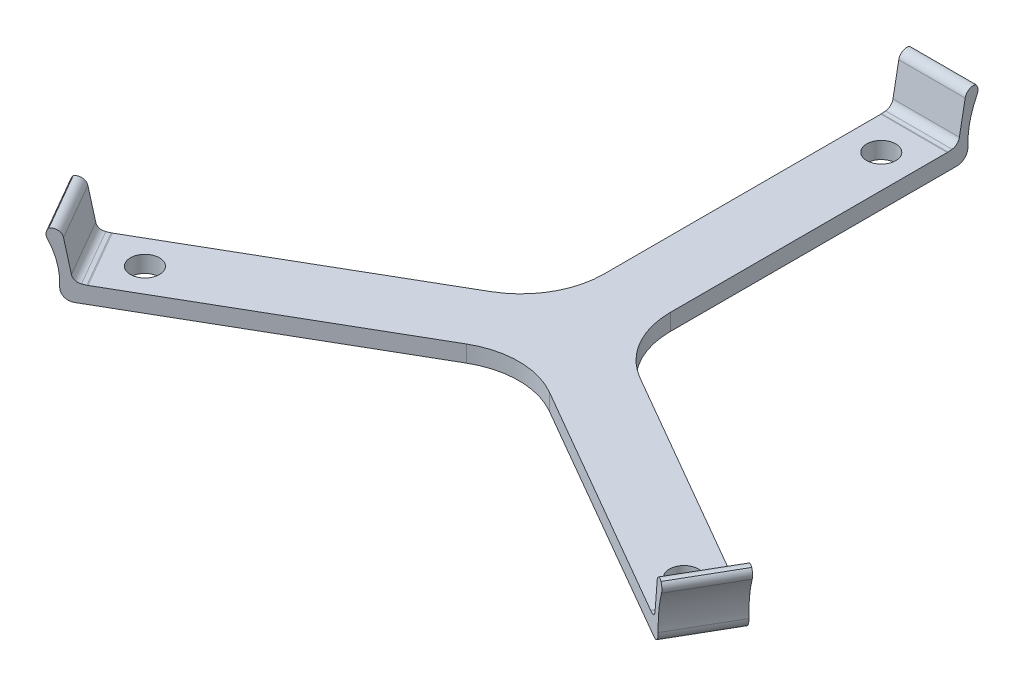
from build123d import *

# Parameters (mm, degrees)
SKETCH1_W                = 8
SKETCH1_H                = 41.5
SKETCH1_R                = 1.75
BOSS_EXTRUDE2_DEPTH      = 2
CIRPATTERN1_COUNT        = 3
BOSS_EXTRUDE4_DEPTH      = 4
FILLET4_R                = 1
FILLET5_R                = 1
CIRPATTERN2_COUNT        = 3
FILLET4_OF_CIRPATTERN2_R = 1
FILLET5_OF_CIRPATTERN2_R = 1
FILLET6_R                = 10


with BuildPart() as part:
    # Sketch1 → Boss-Extrude2 (new body)
    with BuildSketch(Plane(origin=(0, 0, 0), x_dir=(1, 0, 0), z_dir=(0, 1, 0))):
        with Locations((4, 20.75)):
            Rectangle(SKETCH1_W, SKETCH1_H)
        with Locations(Location((4, 37.5, 0), (0, 0, 270))):
            Circle(SKETCH1_R, mode=Mode.SUBTRACT)
    boss_extrude2 = extrude(amount=BOSS_EXTRUDE2_DEPTH)

    # CirPattern1: Boss-Extrude2 ×3 about axis
    cirpattern1_axis = Axis((4, 0, 0), (0, 1, 0))
    for i in range(1, CIRPATTERN1_COUNT):
        add(boss_extrude2.rotate(cirpattern1_axis, i * 360 / CIRPATTERN1_COUNT))

    # Sketch8 → Boss-Extrude4 (add, symmetric)
    with BuildSketch(Plane(origin=(4, 0, 0), x_dir=(0, 0, -1), z_dir=(1, 0, 0))):
        with BuildLine():
            Line((41.5, 0), (42.621101534, 0))
            ThreePointArc((42.621101534, 0), (43.575288985, 0.405725605), (43.945070079, 1.374409713))
            ThreePointArc((43.945070079, 1.374409713), (44.287115262, 4.314035864), (45.5, 7.013537193))
            Line((45.5, 7.013537193), (43.885890552, 8.06067472))
            Line((43.885890552, 8.06067472), (42.771717246, 2.127015587))
            Line((42.771717246, 2.127015587), (41.5, 2))
            Line((41.5, 2), (41.5, 0))
        make_face()
    boss_extrude4 = extrude(amount=BOSS_EXTRUDE4_DEPTH, both=True)

    # Fillet4
    # the kernel refuses this fillet: 1 mm, written as the material it takes off along each edge
    with BuildSketch(Plane(origin=(11.730116112, 8.06067472, -43.885890552), x_dir=(0, -0.9828237835068792, 0.1845464997587953), z_dir=(-1, 0, 0))) as fillet4_piece_1:
        with BuildLine():
            CenterArc((FILLET4_R * 1.49204644486, -FILLET4_R), FILLET4_R, 90, 112.338398351)
            Line((FILLET4_R * 0.567091237268, -FILLET4_R * 1.38007612915), (0, 0))
            Line((0, 0), (FILLET4_R * 1.49204644486, 0))
        make_face()
    extrude(amount=15.460232224, mode=Mode.SUBTRACT)
    with BuildSketch(Plane(origin=(-2.382872769, 7.013537193, -45.5), x_dir=(0, 0.5442451052621637, 0.8389262574256311), z_dir=(1, 0, 0))) as fillet4_piece_2:
        with BuildLine():
            CenterArc((0.953149108, 1), FILLET4_R, 185.36479385, 84.63520615)
            ThreePointArc((-0.042470495, 0.906503441), (-0.010623444, 0.453748893), (0, 0))
            Line((0, 0), (0.953149108, 0))
        make_face()
    extrude(amount=12.765745538, mode=Mode.SUBTRACT)

    # Fillet5
    # the kernel refuses this fillet: 1 mm, written as the material it adds along each edge
    with BuildSketch(Plane(origin=(8, 2, -41.5), x_dir=(0, 0, 1), z_dir=(-1, 0, 0))) as fillet5_piece_1:
        with BuildLine():
            CenterArc((FILLET5_R * 0.0498146888591, FILLET5_R), FILLET5_R, 264.296371881, 5.703628119)
            Line((-FILLET5_R * 0.0495680702218, FILLET5_R * 0.00495072122158), (0, 0))
            Line((0, 0), (FILLET5_R * 0.0498146888591, 0))
        make_face()
    extrude(amount=8)
    with BuildSketch(Plane(origin=(8, 2.127015587, -42.771717246), x_dir=(0, 0.9828237835068792, -0.18454649975879509), z_dir=(-1, 0, 0))) as fillet5_piece_2:
        with BuildLine():
            CenterArc((FILLET5_R * 0.748935389987, -FILLET5_R), FILLET5_R, 90, 73.66167838)
            Line((-FILLET5_R * 0.210681966633, -FILLET5_R * 0.718691399219), (0, 0))
            Line((0, 0), (FILLET5_R * 0.748935389987, 0))
        make_face()
    extrude(amount=8)

    # CirPattern2: Boss-Extrude4 ×3 about axis
    cirpattern2_axis = Axis((4, 0, 0), (0, 1, 0))
    for i in range(1, CIRPATTERN2_COUNT):
        add(boss_extrude4.rotate(cirpattern2_axis, i * 360 / CIRPATTERN2_COUNT))

    # Fillet4 of CirPattern2
    # the kernel refuses this fillet: 1 mm, written as the material it takes off along each edge
    with BuildSketch(Plane(origin=(-37.871354141, 8.06067472, 15.248468348), x_dir=(-0.7265314508324002, -0.5442451052621637, 0.4194631287128154), z_dir=(0.49999999999999983, 0, 0.8660254037844388))) as fillet4_of_cirpattern2_piece_1:
        with BuildLine():
            CenterArc((FILLET4_OF_CIRPATTERN2_R * 1.49204644486, FILLET4_OF_CIRPATTERN2_R), FILLET4_OF_CIRPATTERN2_R, 157.661601649, 112.338398351)
            Line((FILLET4_OF_CIRPATTERN2_R * 0.567091237268, FILLET4_OF_CIRPATTERN2_R * 1.38007612915), (0, 0))
            Line((0, 0), (FILLET4_OF_CIRPATTERN2_R * 1.49204644486, 0))
        make_face()
    extrude(amount=15.460232224, mode=Mode.SUBTRACT)
    with BuildSketch(Plane(origin=(-32.212719488, 7.013537193, 28.277729967), x_dir=(0.43681230013054545, -0.8634774766062033, -0.2521936990657099), z_dir=(-0.49999999999999983, 0, -0.8660254037844388))) as fillet4_of_cirpattern2_piece_2:
        with BuildLine():
            CenterArc((0.954297344, -0.9989043), FILLET4_OF_CIRPATTERN2_R, 92.682396925, 84.63520615)
            Line((-0.044606957, -0.952104742), (0, 0))
            ThreePointArc((0, 0), (0.453748893, -0.010623444), (0.907497786, 0))
        make_face()
    extrude(amount=12.765745538, mode=Mode.SUBTRACT)
    with BuildSketch(Plane(origin=(38.141238029, 8.06067472, 28.637422203), x_dir=(-0.15982195697061236, -0.9828237835068798, -0.09227324987939595), z_dir=(0.5000000000000004, 0, -0.8660254037844384))) as fillet4_of_cirpattern2_piece_3:
        with BuildLine():
            CenterArc((FILLET4_OF_CIRPATTERN2_R * 1.49204644486, -FILLET4_OF_CIRPATTERN2_R), FILLET4_OF_CIRPATTERN2_R, 90, 112.338398351)
            Line((FILLET4_OF_CIRPATTERN2_R * 0.567091237268, -FILLET4_OF_CIRPATTERN2_R * 1.38007612915), (0, 0))
            Line((0, 0), (FILLET4_OF_CIRPATTERN2_R * 1.49204644486, 0))
        make_face()
    extrude(amount=15.460232224, mode=Mode.SUBTRACT)
    with BuildSketch(Plane(origin=(46.595592257, 7.013537193, 17.222270033), x_dir=(-0.7265314508324002, 0.5442451052621633, -0.4194631287128161), z_dir=(-0.5000000000000004, 0, 0.8660254037844384))) as fillet4_of_cirpattern2_piece_4:
        with BuildLine():
            CenterArc((0.953149108, 1), FILLET4_OF_CIRPATTERN2_R, 185.36479385, 84.63520615)
            ThreePointArc((-0.042470495, 0.906503441), (-0.010623444, 0.453748893), (0, 0))
            Line((0, 0), (0.953149108, 0))
        make_face()
    extrude(amount=12.765745538, mode=Mode.SUBTRACT)

    # Fillet5 of CirPattern2
    # the kernel refuses this fillet: 1 mm, written as the material it adds along each edge
    with BuildSketch(Plane(origin=(-33.940054257, 2, 17.285898385), x_dir=(0.8660254037844387, 0, -0.4999999999999998), z_dir=(0.49999999999999983, 0, 0.8660254037844388)), Plane(origin=(37.940054257, 2, 24.214101615), x_dir=(-0.8660254037844384, 0, -0.5000000000000004), z_dir=(0.5000000000000004, 0, -0.8660254037844384))) as fillet5_of_cirpattern2_piece_1:
        with BuildLine():
            CenterArc((FILLET5_OF_CIRPATTERN2_R * 0.0498146888591, FILLET5_OF_CIRPATTERN2_R), FILLET5_OF_CIRPATTERN2_R, 264.296371881, 5.703628119)
            Line((-FILLET5_OF_CIRPATTERN2_R * 0.0495680702218, FILLET5_OF_CIRPATTERN2_R * 0.00495072122158), (0, 0))
            Line((0, 0), (FILLET5_OF_CIRPATTERN2_R * 0.0498146888591, 0))
        make_face()
    extrude(amount=8)
    with BuildSketch(Plane(origin=(-35.041393699, 2.127015587, 17.921757008), x_dir=(0.861737953439498, -0.0993827590809451, -0.4975246393892111), z_dir=(0.49999999999999983, 0, 0.8660254037844388)), Plane(origin=(39.041393699, 2.127015587, 24.849960238), x_dir=(-0.8617379534394976, -0.09938275908094509, -0.49752463938921165), z_dir=(0.5000000000000004, 0, -0.8660254037844384))) as fillet5_of_cirpattern2_piece_2:
        with BuildLine():
            CenterArc((FILLET5_OF_CIRPATTERN2_R * 0.748935389987, FILLET5_OF_CIRPATTERN2_R), FILLET5_OF_CIRPATTERN2_R, 196.33832162, 73.66167838)
            Line((-FILLET5_OF_CIRPATTERN2_R * 0.210681966633, FILLET5_OF_CIRPATTERN2_R * 0.718691399219), (0, 0))
            Line((0, 0), (FILLET5_OF_CIRPATTERN2_R * 0.748935389987, 0))
        make_face()
    extrude(amount=8)

    # Fillet6
    fillet6_edges = [part.edges().sort_by_distance(p)[0] for p in [
        (8, 1, -2.309401077),
        (0, 1, -2.309401077),
        (4, 1, 4.618802154),
    ]]
    fillet(fillet6_edges, radius=FILLET6_R)


solid = part.part
